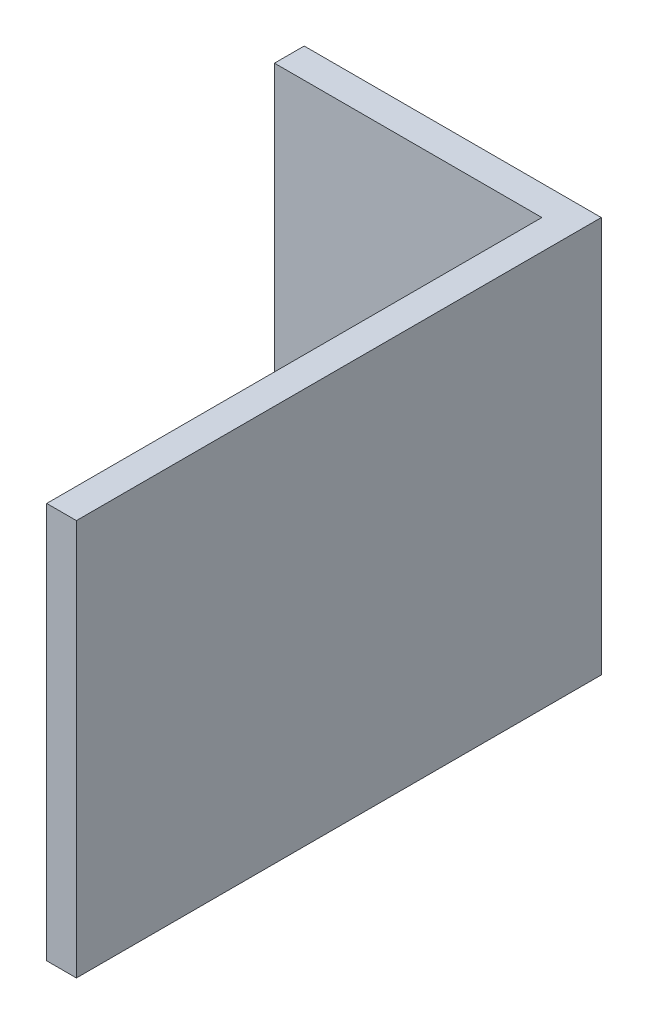
from build123d import *

# Parameters (mm, degrees)
RESSALTO_EXTRUS_O1_DEPTH = 40


with BuildPart() as part:
    # Esboço1 → Ressalto-extrusão1 (new body)
    with BuildSketch(Plane(origin=(0, 0, 0), x_dir=(1, 0, 0), z_dir=(0, 1, 0))):
        Polygon((0, 0), (30, 0), (30, -53), (27, -53), (27, -3), (0, -3), align=None)
    extrude(amount=RESSALTO_EXTRUS_O1_DEPTH)


solid = part.part
